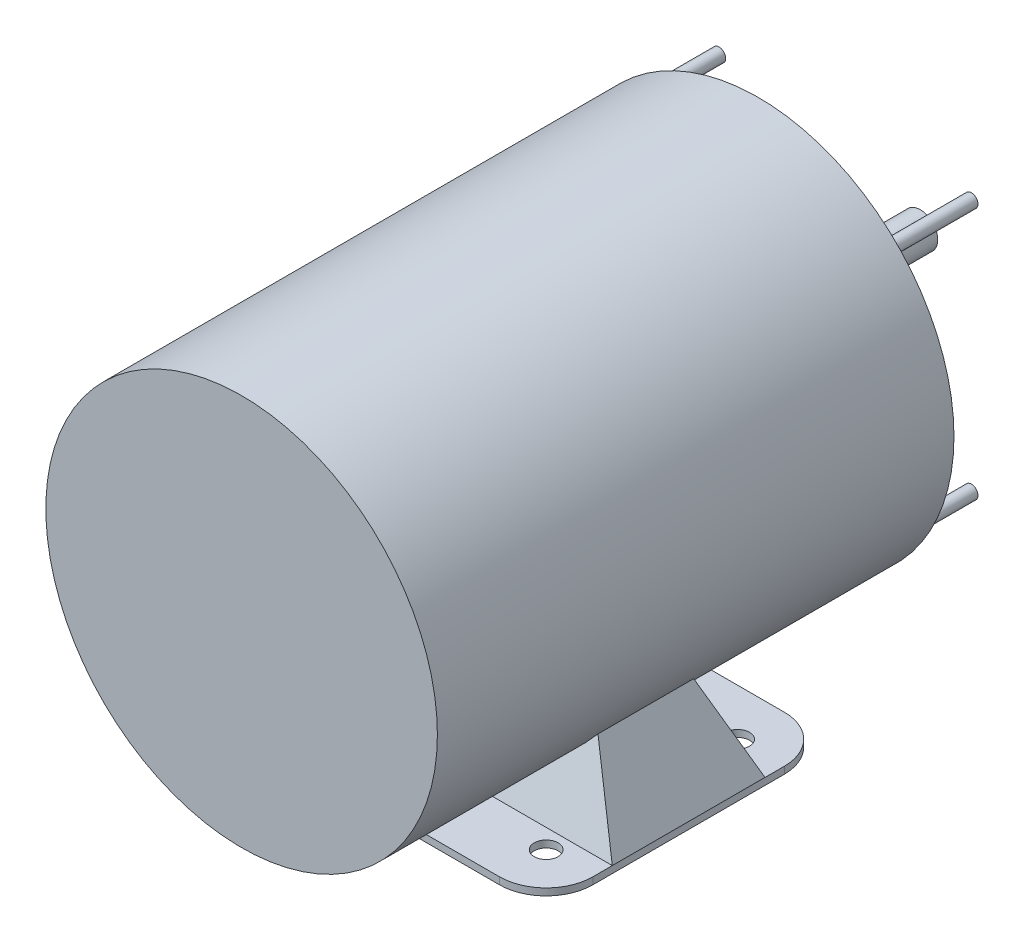
from build123d import *

# Parameters (mm, degrees)
SKETCH2_R                                 = 71.4375
BOSS_EXTRUDE1_DEPTH                       = 188.4934
BOSS_EXTRUDE4_START                       = -188.4934
SKETCH2_3_R                               = 6.35
BOSS_EXTRUDE4_DEPTH                       = 59.1566
BOSS_EXTRUDE2_START                       = -76.2
BOSS_EXTRUDE2_DEPTH                       = 2.54
SKETCH5_W                                 = 4.365625
SKETCH5_H                                 = 147.6375
F_11_32_0_34375_DIAMETER_HOLE1_AT_2_COUNT = 2
F_11_32_0_34375_DIAMETER_HOLE1_AT_2_PITCH = 69.85
F_11_32_0_34375_DIAMETER_HOLE1_AT_3_COUNT = 2
F_11_32_0_34375_DIAMETER_HOLE1_AT_3_PITCH = 128.577700244
F_11_32_0_34375_DIAMETER_HOLE1_AT_4_COUNT = 2
F_11_32_0_34375_DIAMETER_HOLE1_AT_4_PITCH = 107.95
BOSS_EXTRUDE3_START                       = 71.0438
BOSS_EXTRUDE3_DEPTH                       = 142.0876
CUT_EXTRUDE1_START                        = -119.937949444
CUT_EXTRUDE1_DEPTH                        = 55.725898888
BOSS_EXTRUDE5_START                       = -188.4934
SKETCH8_R                                 = 2.413
BOSS_EXTRUDE5_DEPTH                       = 31.75


# Read off the part's stored shape, not the designer's step: Cut-Extrude1
with BuildPart() as part:
    # Sketch2 → Boss-Extrude1 (new body)
    with BuildSketch(Plane.XY):
        Circle(SKETCH2_R)
    extrude(amount=-BOSS_EXTRUDE1_DEPTH)

    # Sketch2<3> → Boss-Extrude4 (add)
    with BuildSketch(Plane.XY.offset(BOSS_EXTRUDE4_START)):
        Circle(SKETCH2_3_R)
    extrude(amount=-BOSS_EXTRUDE4_DEPTH)



with BuildPart() as body_2:
    # Sketch3 → Boss-Extrude2 (new body)
    with BuildSketch(Plane(origin=(0, 0, 0), x_dir=(1, 0, 0), z_dir=(0, 1, 0)).offset(BOSS_EXTRUDE2_START)):
        with BuildLine():
            Line((-53.975, 144.0688), (53.975, 144.0688))
            ThreePointArc((53.975, 144.0688), (66.044464227, 139.069464227), (71.0438, 127))
            Line((71.0438, 127), (71.0438, 57.15))
            ThreePointArc((71.0438, 57.15), (66.044464227, 45.080535773), (53.975, 40.0812))
            Line((53.975, 40.0812), (-53.975, 40.0812))
            ThreePointArc((-53.975, 40.0812), (-66.044464227, 45.080535773), (-71.0438, 57.15))
            Line((-71.0438, 57.15), (-71.0438, 127))
            ThreePointArc((-71.0438, 127), (-66.044464227, 139.069464227), (-53.975, 144.0688))
        make_face()
    extrude(amount=BOSS_EXTRUDE2_DEPTH)

    # Sketch5 → 11/32 (0.34375) Diameter Hole1 (revolve, cut)
    with BuildSketch(Plane(origin=(-53.975, -76.2, -127), x_dir=(0, 0, -1), z_dir=(1, 0, 0))):
        with Locations((2.1828125, 73.81875)):
            Rectangle(SKETCH5_W, SKETCH5_H)
    f_11_32_0_34375_diameter_hole1 = revolve(axis=Axis((-53.975, -82.55, -127), (0, 1, 0)), mode=Mode.SUBTRACT)

    # 11/32 (0.34375) Diameter Hole1 at 2: 11/32 (0.34375) Diameter Hole1 ×2
    with Locations(*[(0, 0, i * F_11_32_0_34375_DIAMETER_HOLE1_AT_2_PITCH) for i in range(1, F_11_32_0_34375_DIAMETER_HOLE1_AT_2_COUNT)]):
        add(f_11_32_0_34375_diameter_hole1, mode=Mode.SUBTRACT)

    # 11/32 (0.34375) Diameter Hole1 at 3: 11/32 (0.34375) Diameter Hole1 ×2
    with Locations(*[Vector(0.8395701571521513, 0, 0.543251278157274) * (i * F_11_32_0_34375_DIAMETER_HOLE1_AT_3_PITCH) for i in range(1, F_11_32_0_34375_DIAMETER_HOLE1_AT_3_COUNT)]):
        add(f_11_32_0_34375_diameter_hole1, mode=Mode.SUBTRACT)

    # 11/32 (0.34375) Diameter Hole1 at 4: 11/32 (0.34375) Diameter Hole1 ×2
    with Locations(*[(i * F_11_32_0_34375_DIAMETER_HOLE1_AT_4_PITCH, 0, 0) for i in range(1, F_11_32_0_34375_DIAMETER_HOLE1_AT_4_COUNT)]):
        add(f_11_32_0_34375_diameter_hole1, mode=Mode.SUBTRACT)


with BuildPart() as part_1:
    add(part.part)

    add(body_2.part)  # Boss-Extrude3 merges body 2
    # Sketch6 → Boss-Extrude3 (add)
    with BuildSketch(Plane(origin=(0, 0, 0), x_dir=(0, 0, -1), z_dir=(1, 0, 0)).offset(BOSS_EXTRUDE3_START)):
        Polygon((64.212050556, -73.66), (74.6125, -45.085), (109.5375, -45.085), (119.937949444, -73.66), align=None)
    extrude(amount=-BOSS_EXTRUDE3_DEPTH)

    # Cut-Extrude1 outline → Cut-Extrude1 (cut)
    with BuildSketch(Plane.XY.offset(CUT_EXTRUDE1_START)):
        Polygon((-71.0438, -73.66), (-55.413528865, -45.085), (-71.0438, -45.085), align=None)
    cut_extrude1 = extrude(amount=CUT_EXTRUDE1_DEPTH, mode=Mode.SUBTRACT)

    # Mirror2: Cut-Extrude1 across plane
    add(cut_extrude1.mirror(Plane(origin=(0, 0, 0), x_dir=(0, 0, 1), z_dir=(1, 0, 0))), mode=Mode.SUBTRACT)

    # Sketch8 → Boss-Extrude5 (add)
    with BuildSketch(Plane.XY.offset(BOSS_EXTRUDE5_START)):
        with Locations((46.0375, -46.0375)):
            Circle(SKETCH8_R)
        with Locations((46.0375, 46.0375)):
            Circle(SKETCH8_R)
        with Locations((-46.0375, 46.0375)):
            Circle(SKETCH8_R)
        with Locations((-46.0375, -46.0375)):
            Circle(SKETCH8_R)
    extrude(amount=-BOSS_EXTRUDE5_DEPTH)


solid = part_1.part
